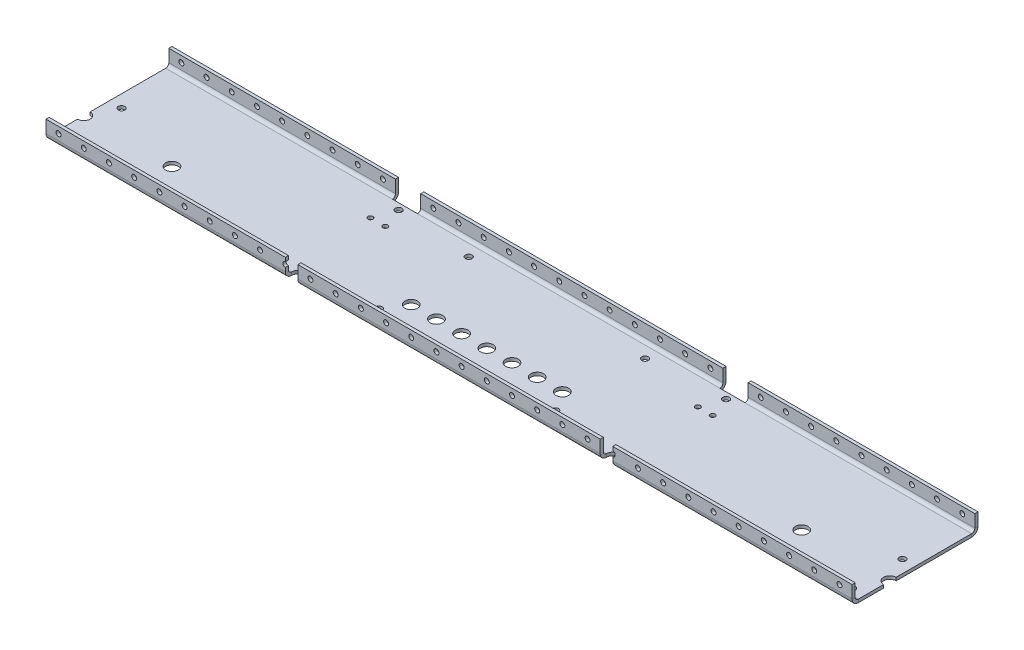
from build123d import *

# Parameters (mm, degrees)
SKETCH1_W                      = 812.8
SKETCH1_H                      = 127
BASE_FLANGE1_DEPTH             = 3.175
EDGE_FLANGE1_STRIP_W           = 19.05
EDGE_FLANGE1_STRIP_H           = 3.175
EDGE_FLANGE1_STRIP_CUT_DEPTH   = 812.8
EDGE_FLANGE1_STRIP_2_W         = 19.05
EDGE_FLANGE1_STRIP_2_H         = 3.175
EDGE_FLANGE1_STRIP_CUT_2_DEPTH = 812.8
EDGE_FLANGE1_DEPTH             = 812.8
EDGE_FLANGE1_BEND_DEPTH        = 812.8
MOUNTING_HOLES_D               = 5
LPATTERN3_COUNT                = 32
LPATTERN3_PITCH                = 25.4
SKETCH21_W                     = 25.4
SKETCH21_H                     = 6.35
CUT_EXTRUDE3_DEPTH             = 412.771918057
CUT_EXTRUDE4_DEPTH             = 412.637250045
CUT_EXTRUDE4_DEPTH_BACK        = 412.637250045
F_80_20_CONNECTION_HOLES_D     = 6.6
MOTOR_HOLES_D                  = 12.7
F_1_2_0_5_DIAMETER_HOLE1_D     = 12.7
CUT_EXTRUDE5_DEPTH             = 412.637250045
F_1_0MM_DOWEL_HOLE1_D          = 6.6
F_5_0MM_DOWEL_HOLE1_D          = 5


# Sheet-metal steps are written as plain solids
with BuildPart() as part:
    # Sketch1 → Base-Flange1 (new body)
    with BuildSketch(Plane(origin=(0, 0, 0), x_dir=(1, 0, 0), z_dir=(0, 1, 0))):
        Rectangle(SKETCH1_W, SKETCH1_H)
    extrude(amount=-BASE_FLANGE1_DEPTH)

    # Edge-Flange1 strip (across the edge) → Edge-Flange1 strip cut (cut)
    with BuildSketch(Plane(origin=(406.4, 0, -63.5), x_dir=(0, 0, 1), z_dir=(-1, 0, 0))):
        with Locations((-3.175, -1.5875)):
            Rectangle(EDGE_FLANGE1_STRIP_W, EDGE_FLANGE1_STRIP_H)
    extrude(amount=EDGE_FLANGE1_STRIP_CUT_DEPTH, mode=Mode.SUBTRACT)

    # Edge-Flange1 strip 2 (across the edge) → Edge-Flange1 strip cut 2 (cut)
    with BuildSketch(Plane(origin=(-406.4, 0, 63.5), x_dir=(0, 0, -1), z_dir=(1, 0, 0))):
        with Locations((-3.175, -1.5875)):
            Rectangle(EDGE_FLANGE1_STRIP_2_W, EDGE_FLANGE1_STRIP_2_H)
    extrude(amount=EDGE_FLANGE1_STRIP_CUT_2_DEPTH, mode=Mode.SUBTRACT)

    # Edge-Flange1 section (across the edge) → Edge-Flange1 (add)
    with BuildSketch(Plane(origin=(406.4, 0, -63.5), x_dir=(0, 0, 1), z_dir=(-1, 0, 0))):
        with BuildLine():
            Line((0, 3.175), (0, 15.875))
            Line((0, 15.875), (3.175, 15.875))
            Line((3.175, 15.875), (3.175, 3.175))
            ThreePointArc((3.175, 3.175), (4.10493597, 0.92993597), (6.35, 0))
            Line((6.35, 0), (6.35, -3.175))
            ThreePointArc((6.35, -3.175), (1.859871939, -1.315128061), (0, 3.175))
        make_face()
    extrude(amount=EDGE_FLANGE1_DEPTH)

    # Edge-Flange1 section 2 (across the edge) → Edge-Flange1 bend (add)
    with BuildSketch(Plane(origin=(-406.4, 0, 63.5), x_dir=(0, 0, -1), z_dir=(1, 0, 0))):
        with BuildLine():
            Line((0, 3.175), (0, 15.875))
            Line((0, 15.875), (3.175, 15.875))
            Line((3.175, 15.875), (3.175, 3.175))
            ThreePointArc((3.175, 3.175), (4.10493597, 0.92993597), (6.35, 0))
            Line((6.35, 0), (6.35, -3.175))
            ThreePointArc((6.35, -3.175), (1.859871939, -1.315128061), (0, 3.175))
        make_face()
    extrude(amount=EDGE_FLANGE1_BEND_DEPTH)

    # Mounting Holes (through all)
    with Locations(Plane(origin=(342.9, 0, -63.5), x_dir=(1, 0, 0), z_dir=(0, 0, -1))):
        with Locations((-736.6, -9.525)):
            mounting_holes = Hole(MOUNTING_HOLES_D / 2)

    # LPattern3: Mounting Holes ×32
    with Locations(*[(i * LPATTERN3_PITCH, 0, 0) for i in range(1, LPATTERN3_COUNT)]):
        add(mounting_holes, mode=Mode.SUBTRACT)

    # Sketch21 → Cut-Extrude3 (cut, through all)
    with BuildSketch(Plane.XZ.offset(3.175)):
        with Locations((165.1, -60.325)):
            Rectangle(SKETCH21_W, SKETCH21_H)
        with Locations((-165.1, -60.325)):
            Rectangle(SKETCH21_W, SKETCH21_H)
    extrude(amount=-CUT_EXTRUDE3_DEPTH, mode=Mode.SUBTRACT)

    # Sketch26 → Cut-Extrude4 (cut, two sides: drawn at the far end of the back side and taken through both)
    with BuildSketch(Plane(origin=(0, 0, 0), x_dir=(1, 0, 0), z_dir=(0, 1, 0)).offset(-CUT_EXTRUDE4_DEPTH_BACK)):
        with BuildLine():
            Line((152.4, -57.15), (152.4, -63.5))
            Line((152.4, -63.5), (165.1, -63.5))
            Line((165.1, -63.5), (165.1, -57.15))
            ThreePointArc((165.1, -57.15), (158.75, -50.8), (152.4, -57.15))
        make_face()
        with BuildLine():
            Line((-165.1, -57.15), (-165.1, -63.5))
            Line((-165.1, -63.5), (-152.4, -63.5))
            Line((-152.4, -63.5), (-152.4, -57.15))
            ThreePointArc((-152.4, -57.15), (-158.75, -50.8), (-165.1, -57.15))
        make_face()
    extrude(amount=CUT_EXTRUDE4_DEPTH + CUT_EXTRUDE4_DEPTH_BACK, mode=Mode.SUBTRACT)

    # 80/20 Connection Holes (through all)
    with Locations(Plane(origin=(0, 0, 0), x_dir=(1, 0, 0), z_dir=(0, 1, 0))):
        with Locations((-165.1, 50.8), (165.1, 50.8), (-393.7, 0), (-393.7, -50.8), (393.7, -50.8), (393.7, 0)):
            Hole(F_80_20_CONNECTION_HOLES_D / 2)

    # Motor Holes (through all)
    with Locations(Plane(origin=(0, 0, 0), x_dir=(1, 0, 0), z_dir=(0, 1, 0))):
        with Locations((-317.5, -25.4), (317.5, -25.4)):
            Hole(MOTOR_HOLES_D / 2)

    # 1/2 (0.5) Diameter Hole1 (through all)
    with Locations(Plane(origin=(0, 0, 0), x_dir=(1, 0, 0), z_dir=(0, 1, 0))):
        with Locations((76.2, -25.4), (0, -25.4), (-25.4, -25.4), (-50.8, -25.4), (-76.2, -25.4), (25.4, -25.4), (50.8, -25.4)):
            Hole(F_1_2_0_5_DIAMETER_HOLE1_D / 2)

    # Sketch33 → Cut-Extrude5 (cut, through all)
    with BuildSketch(Plane(origin=(0, 0, 0), x_dir=(1, 0, 0), z_dir=(0, 1, 0))):
        with BuildLine():
            Line((-406.4, -19.05), (-406.4, -31.75))
            ThreePointArc((-406.4, -31.75), (-400.05, -25.4), (-406.4, -19.05))
        make_face()
        with BuildLine():
            Line((406.4, -19.05), (406.4, -31.75))
            ThreePointArc((406.4, -31.75), (400.05, -25.4), (406.4, -19.05))
        make_face()
    extrude(amount=-CUT_EXTRUDE5_DEPTH, mode=Mode.SUBTRACT)

    # Ø1.0mm Dowel Hole1 (through all)
    with Locations(Plane(origin=(0, 0, 0), x_dir=(1, 0, 0), z_dir=(0, 1, 0))):
        with Locations((88.9, -45.28), (-88.9, 45.28), (-88.9, -45.28), (88.9, 45.28)):
            Hole(F_1_0MM_DOWEL_HOLE1_D / 2)

    # Ø5.0mm Dowel Hole1 (through all)
    with Locations(Plane(origin=(0, 0, 0), x_dir=(1, 0, 0), z_dir=(0, 1, 0))):
        with Locations((172.6, 29.8), (-172.6, 29.8), (-157.6, 29.8), (157.6, 29.8)):
            Hole(F_5_0MM_DOWEL_HOLE1_D / 2)


solid = part.part
